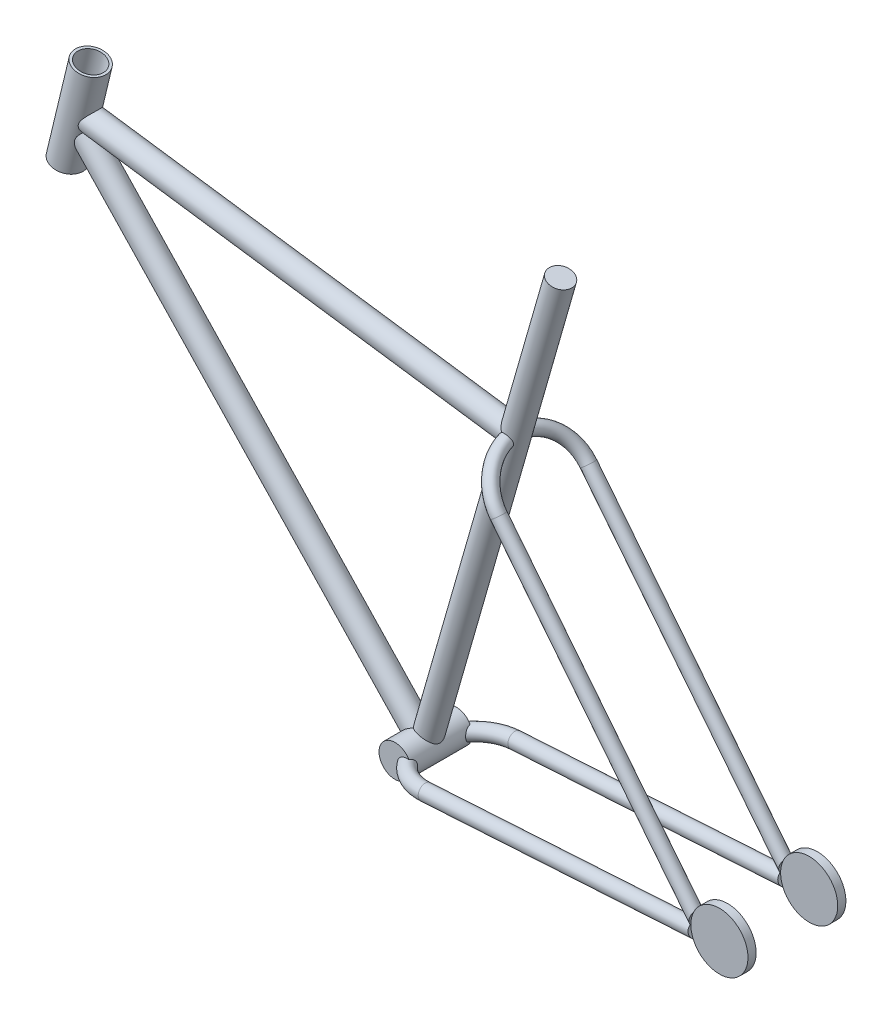
from build123d import *

# Parameters (mm, degrees)
SKETCH_1_R          = 19.65
EXTRUDE_1_DEPTH     = 37.5
SKETCH_3_R          = 14.3
EXTRUDE_2_DEPTH     = 400
SKETCH_4_R          = 14
EXTRUDE_3_DEPTH     = 620
SKETCH_7_R          = 14
EXTRUDE_4_DEPTH     = 540
SKETCH_8_R          = 14.3
EXTRUDE_5_DEPTH     = 200
SKETCH_10_R         = 19.1
EXTRUDE_6_DEPTH     = 60
SKETCH_13_R         = 9
SKETCH_17_R         = 8
CUT_EXTRUDE_1_REACH = 696.529
SKETCH_18_R         = 16
SKETCH_19_R         = 35
EXTRUDE_7_DEPTH     = 10
CUT_EXTRUDE_2_REACH = 749.742
SKETCH_20_R         = 35
CUT_EXTRUDE_3_REACH = 751.332
SKETCH_21_R         = 35


with BuildPart() as part:
    # 草图1 → 凸台-拉伸1 (new, symmetric)
    with BuildSketch(Plane.XY):
        Circle(SKETCH_1_R)
    extrude(amount=EXTRUDE_1_DEPTH, both=True)

    # 草图3 → 凸台-拉伸2 (add)
    with BuildSketch(Plane(origin=(0, 0, 0), x_dir=(0, 0, 1), z_dir=(0.27563735581699983, 0.9612616959383188, 0))):
        Circle(SKETCH_3_R)
    extrude(amount=EXTRUDE_2_DEPTH)

    # 草图4 → 凸台-拉伸3 (add)
    with BuildSketch(Plane(origin=(0, 0, 0), x_dir=(0, 0, 1), z_dir=(-0.6883545756937552, 0.7253743710122865, 0))):
        Circle(SKETCH_4_R)
    extrude(amount=EXTRUDE_3_DEPTH)

    # 草图7 → 凸台-拉伸4 (add)
    with BuildSketch(Plane(origin=(55.127471, -7.747661, 0), x_dir=(0, 0, 1), z_dir=(-0.9902680687415707, 0.13917310096006236, 0))):
        with Locations((0, 396.107227)):
            Circle(SKETCH_7_R)
    extrude(amount=EXTRUDE_4_DEPTH)

    # 草图8 → 凸台-拉伸5 (add)
    with BuildSketch(Plane(origin=(110.254942, 384.504678, 0), x_dir=(0.9612616959383188, -0.27563735581699983, 0), z_dir=(0.2756373558169998, 0.9612616959383187, 0))):
        Circle(SKETCH_8_R)
    extrude(amount=EXTRUDE_5_DEPTH)

    # 草图10 → 凸台-拉伸6 (add, symmetric)
    with BuildSketch(Plane(origin=(81.206907, 338.251111, 0), x_dir=(0, 0, -1), z_dir=(0.23344536385590592, 0.9723699203976764, -4.318341725181594e-15))):
        with Locations((0, 520.066192)):
            Circle(SKETCH_10_R)
    extrude(amount=EXTRUDE_6_DEPTH, both=True)

    # 扫描1: sweep along a path in 草图12
    with BuildLine(Plane(origin=(0, 0, 0), x_dir=(0.998134798421867, 0.06104853953485688, 0), z_dir=(0.06104853953485688, -0.998134798421867, 0))) as sweep_1_path:
        Line((400, 55), (55, 55))
        ThreePointArc((55, 55), (16.109127, 38.890873), (0, 0))
    # 草图13 → 扫描1 (sweep)
    with BuildSketch(Plane(origin=(399.253919, 24.419416, 55), x_dir=(0, 0, 1), z_dir=(-0.998134798421867, -0.06104853953485688, 0))):
        Circle(SKETCH_13_R)
    sweep_1 = sweep(path=sweep_1_path.line)

    # 镜向1: 扫描1 across plane
    add(sweep_1.mirror(Plane.XY))

    # 扫描2: sweep along a path in 草图16
    with BuildLine(Plane(origin=(254.853378, 202.71953, 0), x_dir=(0.622514636637618, -0.7826081568524152, 0), z_dir=(-0.7826081568524152, -0.622514636637618, 0))) as sweep_2_path:
        Line((222.718818, 55), (-177.281182, 55))
        ThreePointArc((-177.281182, 55), (-216.172055, 38.890873), (-232.281182, 0))
    # 草图17 → 扫描2 (sweep)
    with BuildSketch(Plane(origin=(393.499102, 28.417967, 55), x_dir=(0.782608156852415, 0.6225146366376182, 0), z_dir=(-0.6225146366376182, 0.7826081568524151, 0))):
        Circle(SKETCH_17_R)
    sweep_2 = sweep(path=sweep_2_path.line)

    # 镜向2: 扫描2 across plane
    add(sweep_2.mirror(Plane.XY))

    # 草图18 → 切除-拉伸1 (cut, up to next)
    with BuildSketch(Plane(origin=(95.213629, 396.593307, 0), x_dir=(0.9723699203976764, -0.2334453638559059, 1.0367421226654868e-15), z_dir=(0.2334453638559059, 0.9723699203976764, -4.3183417251815914e-15)), mode=Mode.PRIVATE) as cut_extrude_1_sk1:
        with Locations((-520.066192, 0)):
            Circle(SKETCH_18_R)
    cut_extrude_1_tool1 = extrude(cut_extrude_1_sk1.sketch, amount=-CUT_EXTRUDE_1_REACH, mode=Mode.PRIVATE) & part.part
    add(cut_extrude_1_tool1.solids().sort_by_distance((-410.483093, 518.000348, 0))[0], mode=Mode.SUBTRACT)

    # 草图19 → 凸台-拉伸7 (add)
    with BuildSketch(Plane.XY.offset(50)):
        with Locations((420, 30)):
            Circle(SKETCH_19_R)
    extrude_7 = extrude(amount=EXTRUDE_7_DEPTH)

    # 草图20 → 切除-拉伸2 (cut, up to next)
    with BuildSketch(Plane(origin=(0, 0, 50), x_dir=(-1, 0, 0), z_dir=(0, 0, -1)), mode=Mode.PRIVATE) as cut_extrude_2_sk1:
        with Locations((-420, 30)):
            Circle(SKETCH_20_R)
    cut_extrude_2_tool1 = extrude(cut_extrude_2_sk1.sketch, amount=CUT_EXTRUDE_2_REACH, mode=Mode.PRIVATE) & part.part
    cut_extrude_2 = cut_extrude_2_tool1.solids().sort_by_distance((420, 30, 50))[0]
    add(cut_extrude_2, mode=Mode.SUBTRACT)

    # 镜向4: 凸台-拉伸7 across plane
    add(extrude_7.mirror(Plane.XY))

    # 镜向6: 切除-拉伸2 across plane
    add(cut_extrude_2.mirror(Plane.XY), mode=Mode.SUBTRACT)

    # 草图21 → 切除-拉伸3 (cut, up to next)
    with BuildSketch(Plane(origin=(0, 0, -60), x_dir=(-1, 0, 0), z_dir=(0, 0, -1)), mode=Mode.PRIVATE) as cut_extrude_3_sk1:
        with Locations((-420, 30)):
            Circle(SKETCH_21_R)
    cut_extrude_3_tool1 = extrude(cut_extrude_3_sk1.sketch, amount=CUT_EXTRUDE_3_REACH, mode=Mode.PRIVATE) & part.part
    cut_extrude_3 = cut_extrude_3_tool1.solids().sort_by_distance((420, 30, -60))[0]
    add(cut_extrude_3, mode=Mode.SUBTRACT)

    # 镜向7: 切除-拉伸3 across plane
    add(cut_extrude_3.mirror(Plane.XY), mode=Mode.SUBTRACT)


solid = part.part
